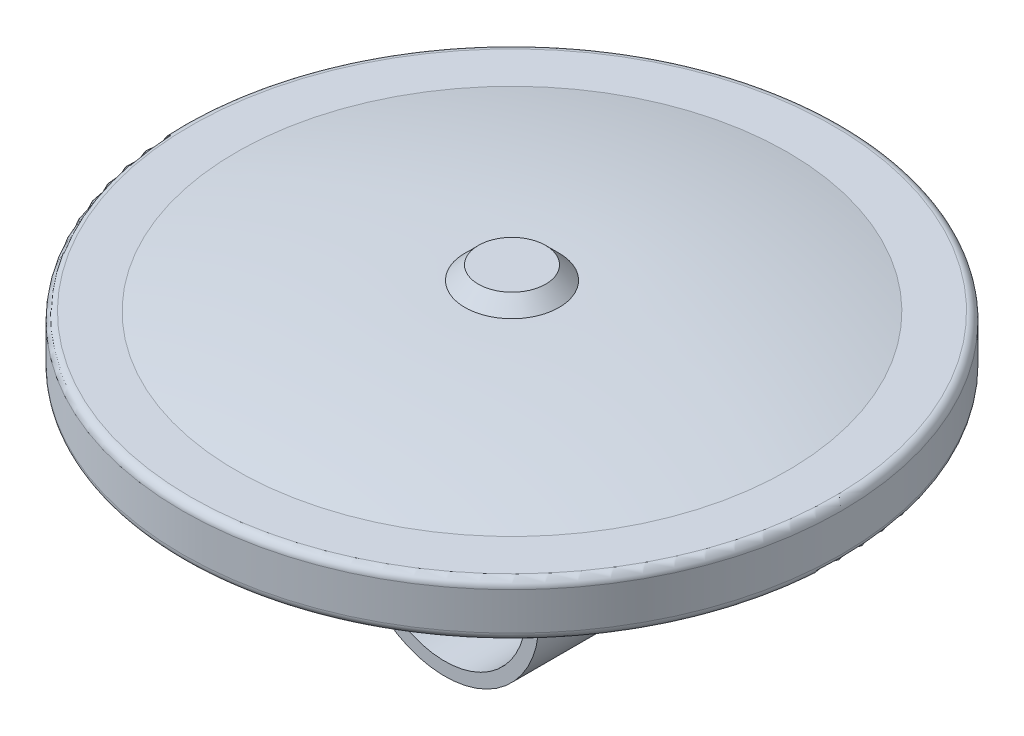
from build123d import *

# Parameters (mm, degrees)
FILLET1_R                       = 3
THREAD1_PITCH                   = 2
SKETCH3_R                       = 35
SKETCH3_R_2                     = 30.15
BOSS_EXTRUDE1_DEPTH             = 25
BOSS_EXTRUDE3_REACH             = 188.849
BOSS_EXTRUDE3_END_RADIUS        = 35
SKETCH2_R                       = 15
SKETCH2_R_2                     = 9.5
BOSS_EXTRUDE3_DIRECTION_2_DEPTH = 15


with BuildPart() as part:
    # Sketch1 → Revolve1 (revolve)
    with BuildSketch(Plane.XY, mode=Mode.PRIVATE) as revolve1_sk:
        with BuildLine():
            Line((11, 0), (11, 30))
            Line((11, 30), (103.839745962, 30))
            Line((103.839745962, 30), (112.5, 15))
            Line((112.5, 15), (122.5, 15))
            Line((122.5, 15), (122.5, 35))
            Line((122.5, 35), (102.5, 35))
            ThreePointArc((102.5, 35), (60.293106922, 42.491408833), (17.5, 45))
            Line((17.5, 45), (12.5, 50))
            Line((12.5, 50), (0, 50))
            Line((0, 50), (0, 40))
            Line((0, 40), (8, 40))
            Line((8, 40), (8, 0))
            Line((8, 0), (11, 0))
        make_face()
    revolve(revolve1_sk.sketch.rotate(Axis((0, 0, 0), (0, 1, 0)), 90), axis=Axis((0, 0, 0), (0, 1, 0)))

    # Fillet1
    fillet1_edges = [part.edges().sort_by_distance(p)[0] for p in [
        (0, 15, 122.5),
        (0, 35, 122.5),
    ]]
    fillet(fillet1_edges, radius=FILLET1_R)

    # Thread1: the profile of Thread Profile1 profile screwed along a right-hand helix of 5 turns, 10 arcs to a turn; built about Z, then put on its axis
    thread1_z = Axis((0, 0, 0), (0, 0, 1))
    thread1_corners = [(11.0003, 0, -0.000173205), (11.0003, 0, 1.7501732), (9.91746825, 0, 1.124999997), (9.91746825, 0, 0.624999997)]
    with BuildLine(mode=Mode.PRIVATE) as thread1_profile:
        Line(thread1_corners[0], thread1_corners[1])
        Line(thread1_corners[1], thread1_corners[2])
        Line(thread1_corners[2], thread1_corners[3])
        Line(thread1_corners[3], thread1_corners[0])
    thread1_cap = Face(thread1_profile.wire())
    thread1_turn_angles = [0, 18, 36, 54, 72, 90, 108, 126, 144, 162, 180, 198, 216, 234, 252, 270, 288, 306, 324, 342, 360]
    thread1_turn_weights = [1, 0.9510565162951535, 1, 0.9510565162951535, 1, 0.9510565162951535, 1, 0.9510565162951535, 1, 0.9510565162951535, 1, 0.9510565162951535, 1, 0.9510565162951535, 1, 0.9510565162951535, 1, 0.9510565162951535, 1, 0.9510565162951535, 1]
    thread1_turn_rails = [Edge.make_bspline([Vector(p[0], p[1], 0).rotate(thread1_z, thread1_turn_angles[k]) / thread1_turn_weights[k] + Vector(0, 0, p[2] + THREAD1_PITCH * thread1_turn_angles[k] / 360) for k in range(21)], [0, 0, 0, 1, 1, 2, 2, 3, 3, 4, 4, 5, 5, 6, 6, 7, 7, 8, 8, 9, 9, 10, 10, 10], 2, thread1_turn_weights) for p in thread1_corners]
    thread1_turn_sides = [Face.make_surface_from_curves(thread1_turn_rails[p[0]], thread1_turn_rails[p[1]]) for p in [(0, 1), (1, 2), (2, 3), (3, 0)]]
    thread1 = Plane(origin=(0, -2, 0), x_dir=(1, 0, 0), z_dir=(0, 1, 0)) * Solid(Shell([*[p.moved(Location((0, 0, THREAD1_PITCH * i))) for i in range(5) for p in thread1_turn_sides], thread1_cap, thread1_cap.rotate(thread1_z, 1800).moved(Location((0, 0, THREAD1_PITCH * 1800 / 360)))]))
    add(thread1, mode=Mode.SUBTRACT)


with BuildPart() as body_2:
    # Sketch3 → Boss-Extrude1 (new, symmetric)
    with BuildSketch(Plane.XY):
        with Locations((0, -35)):
            Circle(SKETCH3_R)
        with Locations((0, -35)):
            Circle(SKETCH3_R_2, mode=Mode.SUBTRACT)
    extrude(amount=BOSS_EXTRUDE1_DEPTH, both=True)


with BuildPart() as body_3:
    # Boss-Extrude3: up to this cylinder (the profile starts outside it)
    boss_extrude3_end = Plane(origin=(0, -35, 14.575736), z_dir=(0, 0, -1)) * Cylinder(BOSS_EXTRUDE3_END_RADIUS, 448.698, mode=Mode.PRIVATE)
    # Sketch2 → Boss-Extrude3 (new, up to the surface)
    with BuildSketch(Plane.XZ, mode=Mode.PRIVATE) as boss_extrude3_sk1:
        with Locations(Location((0, 0, 0), (0, 0, 270))):
            Circle(SKETCH2_R)
        with Locations(Location((0, 0, 0), (0, 0, 270))):
            Circle(SKETCH2_R_2, mode=Mode.SUBTRACT)
    boss_extrude3_tool1 = extrude(boss_extrude3_sk1.sketch, amount=BOSS_EXTRUDE3_REACH, mode=Mode.PRIVATE) - boss_extrude3_end
    add(boss_extrude3_tool1.solids().sort_by_distance((0, 0, 14.575736))[0])
    add(boss_extrude3_tool1.solids().sort_by_distance((0, 0, 14.575736))[1])

    # Sketch2 → Boss-Extrude3 direction 2 (add)
    with BuildSketch(Plane.XZ):
        with Locations(Location((0, 0, 0), (0, 0, 270))):
            Circle(SKETCH2_R)
        with Locations(Location((0, 0, 0), (0, 0, 270))):
            Circle(SKETCH2_R_2, mode=Mode.SUBTRACT)
    extrude(amount=-BOSS_EXTRUDE3_DIRECTION_2_DEPTH)


solid = Compound([part.part, body_2.part, body_3.part])
